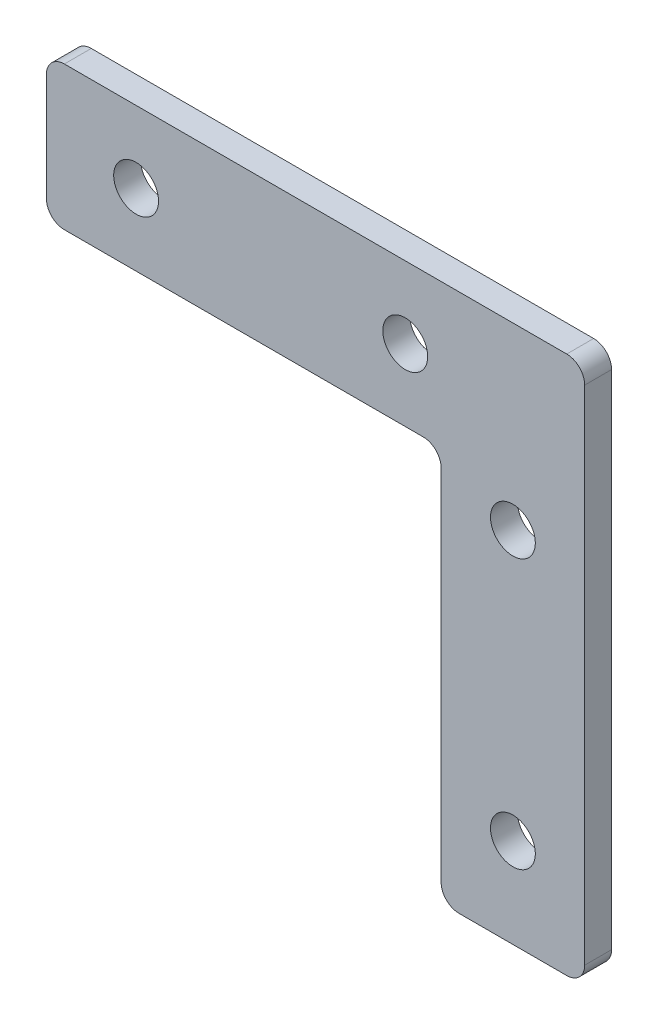
from build123d import *

# Parameters (mm, degrees)
BOSS_EXTRUDE1_DEPTH = 3
SKETCH2_R           = 2.5
CUT_EXTRUDE1_DEPTH  = 3
FILLET1_R           = 2


with BuildPart() as part:
    # Sketch1 → Boss-Extrude1 (new body)
    with BuildSketch(Plane.XY):
        Polygon((0, 0), (44, 0), (44, -44), (60, -44), (60, 0), (60, 16), (0, 16), align=None)
    extrude(amount=BOSS_EXTRUDE1_DEPTH)

    # Sketch2 → Cut-Extrude1 (cut)
    with BuildSketch(Plane.XY.offset(3)):
        with Locations((10, 8)):
            Circle(SKETCH2_R)
        with Locations((40, 8)):
            Circle(SKETCH2_R)
        with Locations((52, -4)):
            Circle(SKETCH2_R)
        with Locations((52, -34)):
            Circle(SKETCH2_R)
    extrude(amount=-CUT_EXTRUDE1_DEPTH, mode=Mode.SUBTRACT)

    # Fillet1
    fillet1_edges = [part.edges().sort_by_distance(p)[0] for p in [
        (44, -44, 1.5),
        (60, -44, 1.5),
        (44, 0, 1.5),
        (60, 16, 1.5),
        (0, 16, 1.5),
        (0, 0, 1.5),
    ]]
    fillet(fillet1_edges, radius=FILLET1_R)


solid = part.part
